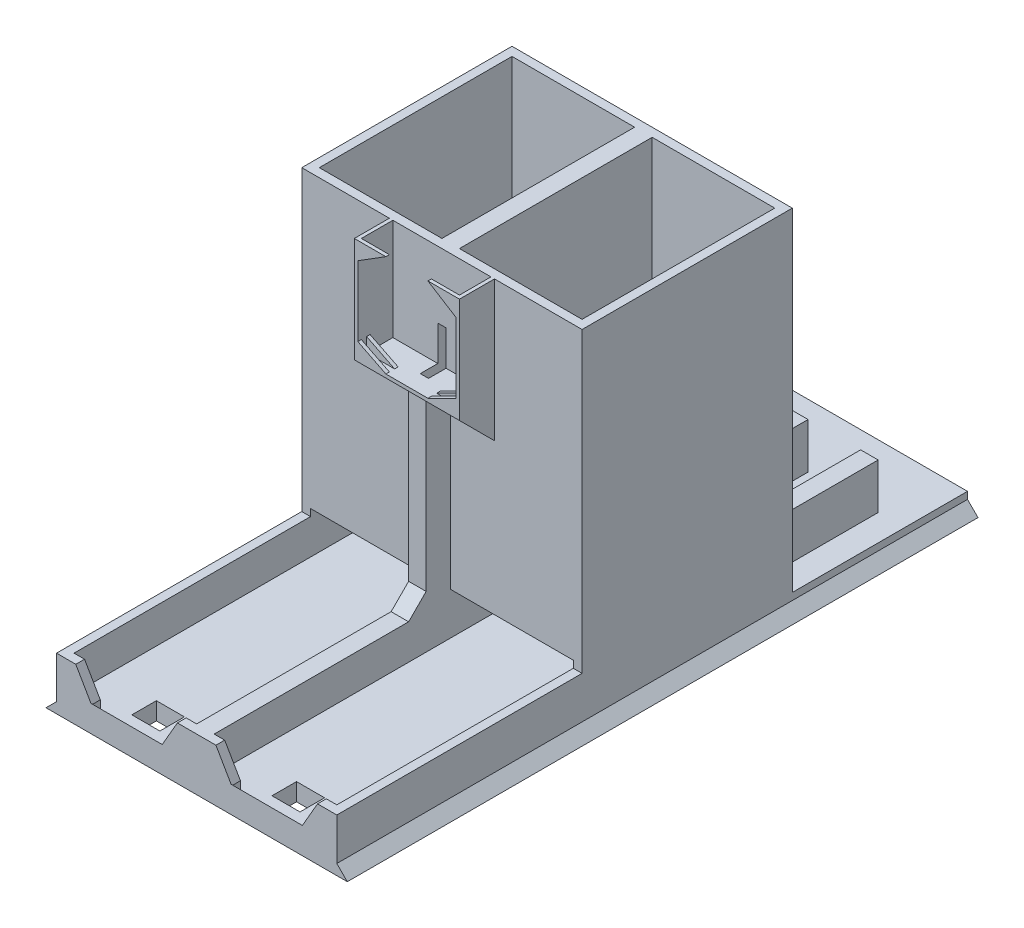
from build123d import *

# Parameters (mm, degrees)
SKETCH1_W                                 = 80
SKETCH1_H                                 = 60
BOSS_EXTRUDE1_DEPTH                       = 100
CUT_EXTRUDE1_START                        = 5
SKETCH2_W                                 = 35
SKETCH2_H                                 = 55
CUT_EXTRUDE1_DEPTH                        = 95
SKETCH3_W                                 = 80
SKETCH3_H                                 = 5
BOSS_EXTRUDE2_DEPTH                       = 70
BOSS_EXTRUDE3_DEPTH                       = 10
SKETCH5_W                                 = 20
SKETCH5_H                                 = 2.5
CUT_EXTRUDE2_DEPTH                        = 7.5
SKETCH6_W                                 = 35
SKETCH6_H                                 = 12
CUT_EXTRUDE4_DEPTH                        = 57.5
CUT_EXTRUDE6_REACH                        = 184.483
SKETCH7_R                                 = 4
SKETCH9_W                                 = 80
SKETCH9_H                                 = 50
BOSS_EXTRUDE4_DEPTH                       = 5
SKETCH13_W                                = 8
SKETCH13_H                                = 7
CUT_EXTRUDE8_BUTTON_HOLES_DEPTH           = 166.90660023
BOSS_EXTRUDE5_OLED_MOUNT_DEPTH            = 10
BOSS_EXTRUDE6_OLED_MOUNT_DEPTH            = 1
BOSS_EXTRUDE7_START                       = -2.5
BOSS_EXTRUDE7_OLED_MOUNT_DEPTH            = 1
BOSS_EXTRUDE8_OLED_MOUNT_DEPTH            = 1
BOSS_EXTRUDE13_OLED_MOUNT_SUPPORT_DEPTH   = 30
CUT_EXTRUDE9_OLED_CABLE_DEPTH             = 10
CUT_EXTRUDE9_OLED_CABLE_DEPTH_BACK        = 154.430766146
SKETCH18_W                                = 2.36
SKETCH18_H                                = 8
BOSS_EXTRUDE12_OLED_CABLE_GUIDE_REACH     = 162.39
SKETCH20_W                                = 5
SKETCH20_H                                = 5
CUT_EXTRUDE10_SOLENOID_WIRE_HOLE_DEPTH    = 166.90660023
SKETCH21_W                                = 5
SKETCH21_H                                = 32
BOSS_EXTRUDE9_SOLENOID_SIDE_SUPPORT_DEPTH = 13
CHAMFER3_THUMB_SIZE                       = 2.5
CHAMFER5_THUMB_SIZE                       = 4.5
CHAMFER5_THUMB_SIZE2                      = 7.794228634
CHAMFER5_THUMB_PART_2_SIZE                = 4.5
CHAMFER5_THUMB_PART_2_SIZE2               = 7.794228634
CHAMFER5_THUMB_PART_3_SIZE                = 4.5
CHAMFER5_THUMB_PART_3_SIZE2               = 7.794228634
BOSS_EXTRUDE5_GUIDE_DEPTH                 = 180
SKETCH49_W                                = 5
SKETCH49_H                                = 5
BOSS_EXTRUDE14_DEPTH                      = 5
CHAMFER8_SIZE                             = 5


with BuildPart() as part:
    # Sketch1 → Boss-Extrude1 (new body)
    with BuildSketch(Plane(origin=(0, 0, 0), x_dir=(1, 0, 0), z_dir=(0, 1, 0))):
        with Locations((40, 30)):
            Rectangle(SKETCH1_W, SKETCH1_H)
    extrude(amount=BOSS_EXTRUDE1_DEPTH)

    # Sketch2 → Cut-Extrude1 (cut)
    with BuildSketch(Plane(origin=(0, 0, 0), x_dir=(1, 0, 0), z_dir=(0, 1, 0)).offset(CUT_EXTRUDE1_START)):
        with Locations((20, 30)):
            Rectangle(SKETCH2_W, SKETCH2_H)
        with Locations((60, 30)):
            Rectangle(SKETCH2_W, SKETCH2_H)
    extrude(amount=CUT_EXTRUDE1_DEPTH, mode=Mode.SUBTRACT)

    # Sketch3 → Boss-Extrude2 (add)
    with BuildSketch(Plane.XY):
        with Locations((40, 2.5)):
            Rectangle(SKETCH3_W, SKETCH3_H)
    extrude(amount=BOSS_EXTRUDE2_DEPTH)

    # Sketch4 → Boss-Extrude3 (add)
    with BuildSketch(Plane(origin=(0, 5, 0), x_dir=(1, 0, 0), z_dir=(0, 1, 0))):
        Polygon((80, 0), (77.5, 0), (77.5, -67.5), (42.5, -67.5), (42.5, 0), (37.5, 0), (37.5, -67.5), (2.5, -67.5), (2.5, 0), (0, 0), (0, -70), (80, -70), align=None)
    extrude(amount=BOSS_EXTRUDE3_DEPTH)

    # Sketch5 → Cut-Extrude2 (cut)
    with BuildSketch(Plane(origin=(0, 15, 0), x_dir=(1, 0, 0), z_dir=(0, 1, 0))):
        with Locations((20, -68.75)):
            Rectangle(SKETCH5_W, SKETCH5_H)
        with Locations((60, -68.75)):
            Rectangle(SKETCH5_W, SKETCH5_H)
    extrude(amount=-CUT_EXTRUDE2_DEPTH, mode=Mode.SUBTRACT)

    # Sketch6 → Cut-Extrude4 (cut)
    with BuildSketch(Plane.XY):
        with Locations((20, 11)):
            Rectangle(SKETCH6_W, SKETCH6_H)
        with Locations((60, 11)):
            Rectangle(SKETCH6_W, SKETCH6_H)
    extrude(amount=-CUT_EXTRUDE4_DEPTH, mode=Mode.SUBTRACT)

    # Sketch7 → Cut-Extrude6 (cut, up to next)
    with BuildSketch(Plane(origin=(0, 0, -60), x_dir=(-1, 0, 0), z_dir=(0, 0, -1)), mode=Mode.PRIVATE) as cut_extrude6_sk1:
        with Locations((-20, 11.5)):
            Circle(SKETCH7_R)
    cut_extrude6_tool1 = extrude(cut_extrude6_sk1.sketch, amount=-CUT_EXTRUDE6_REACH, mode=Mode.PRIVATE) & part.part
    # Sketch7 → Cut-Extrude6 (cut, up to next)
    with BuildSketch(Plane(origin=(0, 0, -60), x_dir=(-1, 0, 0), z_dir=(0, 0, -1)), mode=Mode.PRIVATE) as cut_extrude6_sk2:
        with Locations((-60, 11.5)):
            Circle(SKETCH7_R)
    cut_extrude6_tool2 = extrude(cut_extrude6_sk2.sketch, amount=-CUT_EXTRUDE6_REACH, mode=Mode.PRIVATE) & part.part
    add(cut_extrude6_tool1.solids().sort_by_distance((20, 11.5, -60))[0], mode=Mode.SUBTRACT)
    add(cut_extrude6_tool2.solids().sort_by_distance((60, 11.5, -60))[0], mode=Mode.SUBTRACT)

    # Sketch9 → Boss-Extrude4 (add)
    with BuildSketch(Plane(origin=(0, 0, 0), x_dir=(1, 0, 0), z_dir=(0, 1, 0))):
        with Locations((40, 85)):
            Rectangle(SKETCH9_W, SKETCH9_H)
    extrude(amount=BOSS_EXTRUDE4_DEPTH)

    # Sketch13 → Cut-Extrude8 (Button Holes) (cut, through all)
    with BuildSketch(Plane(origin=(0, 5, 0), x_dir=(1, 0, 0), z_dir=(0, 1, 0))):
        with Locations((20, -61)):
            Rectangle(SKETCH13_W, SKETCH13_H)
        with Locations((60, -61)):
            Rectangle(SKETCH13_W, SKETCH13_H)
    extrude(amount=-CUT_EXTRUDE8_BUTTON_HOLES_DEPTH, mode=Mode.SUBTRACT)

    # Sketch14 → Boss-Extrude5 (OLED Mount) (add)
    with BuildSketch(Plane.XY):
        Polygon((25, 100), (26, 100), (26, 71), (54, 71), (54, 100), (55, 100), (55, 70), (54, 70), (26, 70), (25, 70), align=None)
    extrude(amount=BOSS_EXTRUDE5_OLED_MOUNT_DEPTH)

    # Sketch15 → Boss-Extrude6 (OLED Mount) (add)
    with BuildSketch(Plane.XY.offset(10)):
        Polygon((26, 71), (34, 71), (26, 75), align=None)
        Polygon((54, 75), (54, 71), (46, 71), align=None)
    extrude(amount=-BOSS_EXTRUDE6_OLED_MOUNT_DEPTH)

    # Sketch15<2> → Boss-Extrude7 (OLED Mount) (add)
    with BuildSketch(Plane.XY.offset(10).offset(BOSS_EXTRUDE7_START)):
        Polygon((26, 71), (34, 71), (26, 75), align=None)
        Polygon((54, 75), (54, 71), (46, 71), align=None)
    extrude(amount=-BOSS_EXTRUDE7_OLED_MOUNT_DEPTH)

    # Sketch17 → Boss-Extrude8 (OLED Mount) (add)
    with BuildSketch(Plane.XY.offset(10)):
        Polygon((54, 95), (54, 100), (46, 100), align=None)
        Polygon((26, 100), (34, 100), (26, 95), align=None)
    extrude(amount=-BOSS_EXTRUDE8_OLED_MOUNT_DEPTH)

    # Sketch32 → Boss-Extrude13 OLED Mount Support) (add)
    with BuildSketch(Plane.ZY.offset(-25)):
        Polygon((0, 70), (10, 70), (0, 60), align=None)
    extrude(amount=-BOSS_EXTRUDE13_OLED_MOUNT_SUPPORT_DEPTH)

    # Sketch18 → Cut-Extrude9 (OLED Cable) (cut, two sides: drawn at the far end of the back side and taken through both)
    with BuildSketch(Plane(origin=(0, 71, 0), x_dir=(1, 0, 0), z_dir=(0, 1, 0)).offset(-CUT_EXTRUDE9_OLED_CABLE_DEPTH_BACK)):
        with Locations((40, -1)):
            Rectangle(SKETCH18_W, SKETCH18_H)
    extrude(amount=CUT_EXTRUDE9_OLED_CABLE_DEPTH + CUT_EXTRUDE9_OLED_CABLE_DEPTH_BACK, mode=Mode.SUBTRACT)

    # Boss-Extrude12 (OLED Cable Guide): up to this plane
    boss_extrude12_oled_cable_guide_end = Plane(origin=(55, 70, 10), z_dir=(0, -0.7071067811865477, 0.7071067811865474))
    # Sketch31 → Boss-Extrude12 (OLED Cable Guide) (add, up to the surface)
    with BuildSketch(Plane(origin=(0, 15, 0), x_dir=(1, 0, 0), z_dir=(0, 1, 0)), mode=Mode.PRIVATE) as boss_extrude12_oled_cable_guide_sk1:
        Polygon((37.5, 0), (38.82, 0), (38.82, -5), (41.18, -5), (41.18, 0), (42.5, 0), (42.5, -7), (37.5, -7), align=None)
    boss_extrude12_oled_cable_guide_tool1 = split(extrude(boss_extrude12_oled_cable_guide_sk1.sketch, amount=BOSS_EXTRUDE12_OLED_CABLE_GUIDE_REACH, mode=Mode.PRIVATE), bisect_by=boss_extrude12_oled_cable_guide_end, keep=Keep.BOTH, mode=Mode.PRIVATE)
    add(boss_extrude12_oled_cable_guide_tool1.solids().sort_by_distance((38.16, 15, 0.086023))[0])

    # Sketch20 → Cut-Extrude10 (Solenoid Wire Hole) (cut, through all)
    with BuildSketch(Plane(origin=(0, 5, 0), x_dir=(1, 0, 0), z_dir=(0, 1, 0))):
        with Locations((60, 62.5)):
            Rectangle(SKETCH20_W, SKETCH20_H)
        with Locations((20, 62.5)):
            Rectangle(SKETCH20_W, SKETCH20_H)
    extrude(amount=-CUT_EXTRUDE10_SOLENOID_WIRE_HOLE_DEPTH, mode=Mode.SUBTRACT)

    # Sketch21 → Boss-Extrude9 (Solenoid Side Support) (add)
    with BuildSketch(Plane(origin=(0, 5, 0), x_dir=(1, 0, 0), z_dir=(0, 1, 0))):
        with Locations((70, 76)):
            Rectangle(SKETCH21_W, SKETCH21_H)
        with Locations((50, 76)):
            Rectangle(SKETCH21_W, SKETCH21_H)
        with Locations((30, 76)):
            Rectangle(SKETCH21_W, SKETCH21_H)
        with Locations((10, 76)):
            Rectangle(SKETCH21_W, SKETCH21_H)
    extrude(amount=BOSS_EXTRUDE9_SOLENOID_SIDE_SUPPORT_DEPTH)

    # Chamfer3 (Thumb)
    chamfer3_thumb_edges = [part.edges().sort_by_distance(p)[0] for p in [
        (20, 7.5, 67.5),
        (60, 7.5, 67.5),
    ]]
    chamfer(chamfer3_thumb_edges, length=CHAMFER3_THUMB_SIZE - 0.0001)  # a hair under: the kernel refuses the full size

    # Chamfer5 (Thumb)
    chamfer5_thumb_edges = [part.edges().sort_by_distance(p)[0] for p in [
        (70, 15, 68.75),
    ]]
    chamfer5_thumb_side = [part.faces().sort_by_distance(p)[0] for p in [
        (78.266129032, 15, 38.266129032),
    ]]
    chamfer(chamfer5_thumb_edges, length=CHAMFER5_THUMB_SIZE, length2=CHAMFER5_THUMB_SIZE2, reference=chamfer5_thumb_side[0])

    # Chamfer5 (Thumb) part 2
    chamfer5_thumb_part_2_edges = [part.edges().sort_by_distance(p)[0] for p in [
        (50, 15, 68.75),
        (30, 15, 68.75),
    ]]
    chamfer5_thumb_part_2_side = [part.faces().sort_by_distance(p)[0] for p in [
        (40, 15, 41.718085106),
    ]]
    chamfer(chamfer5_thumb_part_2_edges, length=CHAMFER5_THUMB_PART_2_SIZE, length2=CHAMFER5_THUMB_PART_2_SIZE2, reference=chamfer5_thumb_part_2_side[0])

    # Chamfer5 (Thumb) part 3
    chamfer5_thumb_part_3_edges = [part.edges().sort_by_distance(p)[0] for p in [
        (10, 15, 68.75),
    ]]
    chamfer5_thumb_part_3_side = [part.faces().sort_by_distance(p)[0] for p in [
        (1.733870968, 15, 38.266129032),
    ]]
    chamfer(chamfer5_thumb_part_3_edges, length=CHAMFER5_THUMB_PART_3_SIZE, length2=CHAMFER5_THUMB_PART_3_SIZE2, reference=chamfer5_thumb_part_3_side[0])

    # Sketch37 → Boss-Extrude5 (Guide) (add, through all)
    with BuildSketch(Plane.XY.offset(70)):
        Polygon((80, 0), (83, 0), (80, 3), align=None)
        Polygon((0, 0), (-3, 0), (0, 3), align=None)
    extrude(amount=-BOSS_EXTRUDE5_GUIDE_DEPTH)

    # Sketch49 → Boss-Extrude14 (add)
    with BuildSketch(Plane(origin=(0, 15, 0), x_dir=(1, 0, 0), z_dir=(0, 1, 0))):
        with Locations((40, -9.5)):
            Rectangle(SKETCH49_W, SKETCH49_H)
    extrude(amount=BOSS_EXTRUDE14_DEPTH)

    # Chamfer8
    chamfer8_edges = [part.edges().sort_by_distance(p)[0] for p in [
        (40, 20, 12),
    ]]
    chamfer(chamfer8_edges, length=CHAMFER8_SIZE - 0.0001)  # a hair under: the kernel refuses the full size


solid = part.part
